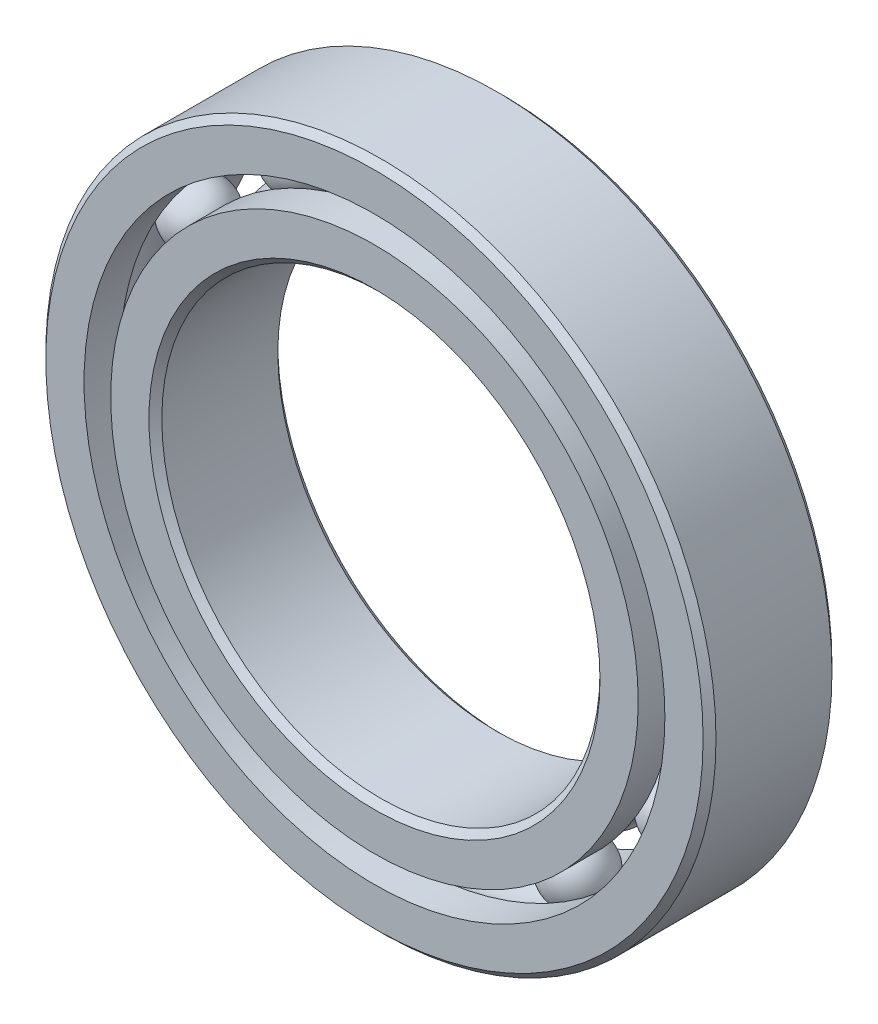
from build123d import *

# Parameters (mm, degrees)
CIRPATTERN1_COUNT = 12


with BuildPart() as part:
    # Sketch1 → Revolve1 (revolve)
    with BuildSketch(Plane(origin=(0, 0, 0), x_dir=(0, 0, -1), z_dir=(1, 0, 0))):
        with BuildLine():
            Line((2.25, 13), (-2.25, 13))
            Line((-2.25, 13), (-2.5, 12.75))
            Line((-2.5, 12.75), (-2.5, 11.267365936))
            Line((-2.5, 11.267365936), (-1.111111111, 11.267365936))
            ThreePointArc((-1.111111111, 11.267365936), (0, 11.975657135), (1.111111111, 11.267365936))
            Line((1.111111111, 11.267365936), (2.5, 11.267365936))
            Line((2.5, 11.267365936), (2.5, 12.75))
            Line((2.5, 12.75), (2.25, 13))
        make_face()
    revolve(axis=Axis((0, 0, 2.5), (0, 0, -1)))


with BuildPart() as body_2:
    # Sketch3 → Revolve3 (revolve)
    with BuildSketch(Plane(origin=(0, 0, 0), x_dir=(0, 0, -1), z_dir=(1, 0, 0))):
        with BuildLine():
            Line((-2.5, 10.232634064), (-1.111111111, 10.232634064))
            ThreePointArc((-1.111111111, 10.232634064), (0, 9.524342865), (1.111111111, 10.232634064))
            Line((1.111111111, 10.232634064), (2.5, 10.232634064))
            Line((2.5, 10.232634064), (2.5, 8.75))
            Line((2.5, 8.75), (2.25, 8.5))
            Line((2.25, 8.5), (-2.25, 8.5))
            Line((-2.25, 8.5), (-2.5, 8.75))
            Line((-2.5, 8.75), (-2.5, 10.232634064))
        make_face()
    revolve(axis=Axis((0, 0, 2.5), (0, 0, -1)))


with BuildPart() as body_3:
    # Sketch4 → Revolve4 (revolve)
    with BuildSketch(Plane(origin=(0, 0, 0), x_dir=(0, 0, -1), z_dir=(1, 0, 0))):
        with BuildLine():
            Line((-1.225657135, 10.75), (1.225657135, 10.75))
            ThreePointArc((1.225657135, 10.75), (0, 11.975657135), (-1.225657135, 10.75))
        make_face()
    revolve(axis=Axis((0, 10.75, 1.225657135), (0, 0, -1)))


with BuildPart() as cirpattern1_1:
    # CirPattern1: pattern copy
    add(body_3.part.rotate(Axis((0, 0, -2.5), (0, 0, 1)), 1 * 360 / CIRPATTERN1_COUNT))


with BuildPart() as cirpattern1_2:
    # CirPattern1: pattern copy
    add(body_3.part.rotate(Axis((0, 0, -2.5), (0, 0, 1)), 2 * 360 / CIRPATTERN1_COUNT))


with BuildPart() as cirpattern1_3:
    # CirPattern1: pattern copy
    add(body_3.part.rotate(Axis((0, 0, -2.5), (0, 0, 1)), 3 * 360 / CIRPATTERN1_COUNT))


with BuildPart() as cirpattern1_4:
    # CirPattern1: pattern copy
    add(body_3.part.rotate(Axis((0, 0, -2.5), (0, 0, 1)), 4 * 360 / CIRPATTERN1_COUNT))


with BuildPart() as cirpattern1_5:
    # CirPattern1: pattern copy
    add(body_3.part.rotate(Axis((0, 0, -2.5), (0, 0, 1)), 5 * 360 / CIRPATTERN1_COUNT))


with BuildPart() as cirpattern1_6:
    # CirPattern1: pattern copy
    add(body_3.part.rotate(Axis((0, 0, -2.5), (0, 0, 1)), 6 * 360 / CIRPATTERN1_COUNT))


with BuildPart() as cirpattern1_7:
    # CirPattern1: pattern copy
    add(body_3.part.rotate(Axis((0, 0, -2.5), (0, 0, 1)), 7 * 360 / CIRPATTERN1_COUNT))


with BuildPart() as cirpattern1_8:
    # CirPattern1: pattern copy
    add(body_3.part.rotate(Axis((0, 0, -2.5), (0, 0, 1)), 8 * 360 / CIRPATTERN1_COUNT))


with BuildPart() as cirpattern1_9:
    # CirPattern1: pattern copy
    add(body_3.part.rotate(Axis((0, 0, -2.5), (0, 0, 1)), 9 * 360 / CIRPATTERN1_COUNT))


with BuildPart() as cirpattern1_10:
    # CirPattern1: pattern copy
    add(body_3.part.rotate(Axis((0, 0, -2.5), (0, 0, 1)), 10 * 360 / CIRPATTERN1_COUNT))


with BuildPart() as cirpattern1_11:
    # CirPattern1: pattern copy
    add(body_3.part.rotate(Axis((0, 0, -2.5), (0, 0, 1)), 11 * 360 / CIRPATTERN1_COUNT))


solid = Compound([part.part, body_2.part, body_3.part, cirpattern1_1.part, cirpattern1_2.part, cirpattern1_3.part, cirpattern1_4.part, cirpattern1_5.part, cirpattern1_6.part, cirpattern1_7.part, cirpattern1_8.part, cirpattern1_9.part, cirpattern1_10.part, cirpattern1_11.part])
